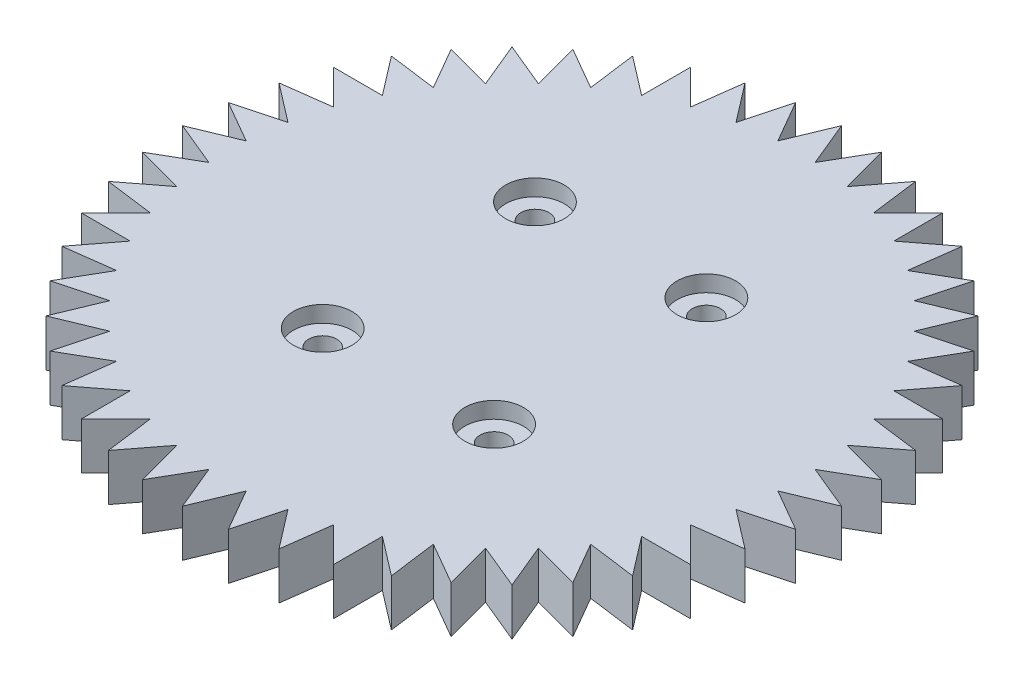
from build123d import *

# Parameters (mm, degrees)
BOSS_EXTRUDE1_DEPTH                                 = 6.35
CBORE_FOR_6_BINDING_HEAD_MACHINE_SCREW1_D           = 3.7973
CBORE_FOR_6_BINDING_HEAD_MACHINE_SCREW1_CBORE_D     = 7.9375
CBORE_FOR_6_BINDING_HEAD_MACHINE_SCREW1_CBORE_DEPTH = 2.2098


# Read off the part's stored shape, not the designer's step: Boss-Extrude1
with BuildPart() as part:
    # Boss-Extrude1 outline → Boss-Extrude1 (new body)
    with BuildSketch(Plane(origin=(0, 0, 0), x_dir=(1, 0, 0), z_dir=(0, 1, 0))):
        Polygon((-7.531933394, 37.865586202), (-11.548701317, 43.100340077), (-12.409947442, 36.558526277), (-17.07562385, 41.224202684), (-17.07562385, 34.625939831), (-22.310377724, 38.642707755), (-21.449131599, 32.100893955), (-27.16339485, 35.400025382), (-25.45563876, 29.026592883), (-31.55163876, 31.55163876), (-29.026592883, 25.45563876), (-35.400025382, 27.16339485), (-32.100893955, 21.449131599), (-38.642707755, 22.310377724), (-34.625939831, 17.07562385), (-41.224202684, 17.07562385), (-36.558526277, 12.409947442), (-43.100340077, 11.548701317), (-37.865586202, 7.531933394), (-44.2390187, 5.824177303), (-38.524755449, 2.525045876), (-44.620755449, 0), (-38.524755449, -2.525045876), (-44.2390187, -5.824177303), (-37.865586202, -7.531933394), (-43.100340077, -11.548701317), (-36.558526277, -12.409947442), (-41.224202684, -17.07562385), (-34.625939831, -17.07562385), (-38.642707755, -22.310377724), (-32.100893955, -21.449131599), (-35.400025382, -27.16339485), (-29.026592883, -25.45563876), (-31.55163876, -31.55163876), (-25.45563876, -29.026592883), (-27.16339485, -35.400025382), (-21.449131599, -32.100893955), (-22.310377724, -38.642707755), (-17.07562385, -34.625939831), (-17.07562385, -41.224202684), (-12.409947442, -36.558526277), (-11.548701317, -43.100340077), (-7.531933394, -37.865586202), (-5.824177303, -44.2390187), (-2.525045876, -38.524755449), (0, -44.620755449), (2.525045876, -38.524755449), (5.824177303, -44.2390187), (7.531933394, -37.865586202), (11.548701317, -43.100340077), (12.409947442, -36.558526277), (17.07562385, -41.224202684), (17.07562385, -34.625939831), (22.310377724, -38.642707755), (21.449131599, -32.100893955), (27.16339485, -35.400025382), (25.45563876, -29.026592883), (31.55163876, -31.55163876), (29.026592883, -25.45563876), (35.400025382, -27.16339485), (32.100893955, -21.449131599), (38.642707755, -22.310377724), (34.625939831, -17.07562385), (41.224202684, -17.07562385), (36.558526277, -12.409947442), (43.100340077, -11.548701317), (37.865586202, -7.531933394), (44.2390187, -5.824177303), (38.524755449, -2.525045876), (44.620755449, 0), (38.524755449, 2.525045876), (44.2390187, 5.824177303), (37.865586202, 7.531933394), (43.100340077, 11.548701317), (36.558526277, 12.409947442), (41.224202684, 17.07562385), (34.625939831, 17.07562385), (38.642707755, 22.310377724), (32.100893955, 21.449131599), (35.400025382, 27.16339485), (29.026592883, 25.45563876), (31.55163876, 31.55163876), (25.45563876, 29.026592883), (27.16339485, 35.400025382), (21.449131599, 32.100893955), (22.310377724, 38.642707755), (17.07562385, 34.625939831), (17.07562385, 41.224202684), (12.409947442, 36.558526277), (11.548701317, 43.100340077), (7.531933394, 37.865586202), (5.824177303, 44.2390187), (2.525045876, 38.524755449), (0, 44.620755449), (-2.525045876, 38.524755449), (-5.824177303, 44.2390187), align=None)
    extrude(amount=BOSS_EXTRUDE1_DEPTH)

    # CBORE for #6 Binding Head Machine Screw1 (through all)
    with Locations(Plane(origin=(-11.826685844, 6.35, -14.934255989), x_dir=(0, 0, 1), z_dir=(0, 1, 0))):
        with Locations((0, 0), (-0.354715182, 22.86), (28.855284818, 23.322273825), (29.21, 0.462273825)):
            CounterBoreHole(CBORE_FOR_6_BINDING_HEAD_MACHINE_SCREW1_D / 2, CBORE_FOR_6_BINDING_HEAD_MACHINE_SCREW1_CBORE_D / 2, CBORE_FOR_6_BINDING_HEAD_MACHINE_SCREW1_CBORE_DEPTH)


solid = part.part
